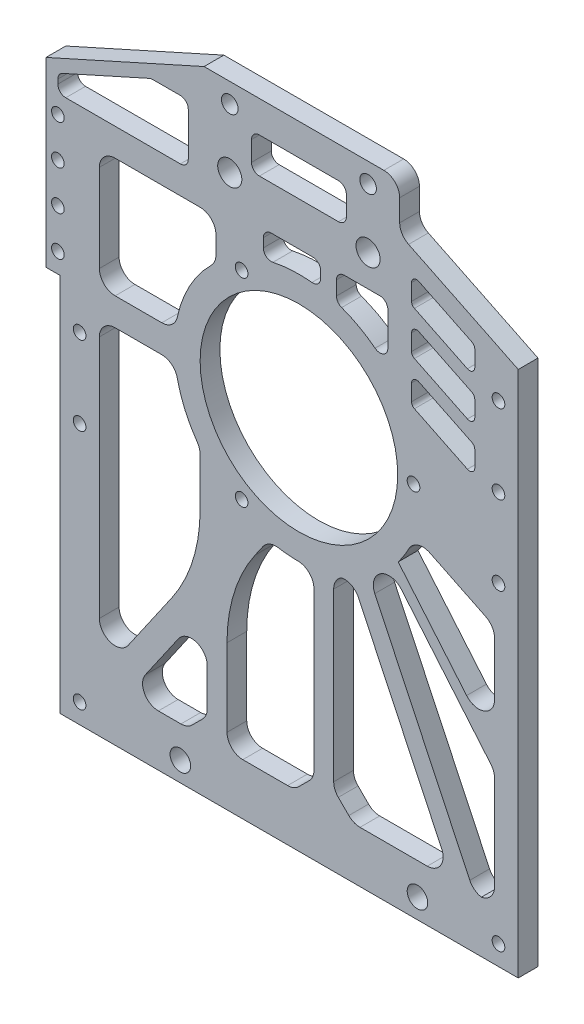
from build123d import *

# Parameters (mm, degrees)
SKETCH_1_W                     = 111
SKETCH_1_H                     = 160
EXTRUDE_1_DEPTH                = 5
SKETCH_2_R                     = 2.6
CUT_EXTRUDE_1_DEPTH            = 98.49487166
SKETCH_3_R                     = 25
CUT_EXTRUDE_2_DEPTH            = 98.49487166
SKETCH_4_R                     = 1.6
CUT_EXTRUDE_3_DEPTH            = 98.49487166
SKETCH_6_R                     = 2.1
SKETCH_6_R_2                   = 3.0525
CUT_EXTRUDE_4_DEPTH            = 98.49487166
CUT_EXTRUDE_5_DEPTH            = 98.49487166
CUT_EXTRUDE_6_DEPTH            = 98.49487166
FILLET_1_R                     = 4
SKETCH_10_W                    = 8.5
SKETCH_10_H                    = 64
EXTRUDE_3_DEPTH                = 5
SKETCH_11_R                    = 1.6
CUT_EXTRUDE_7_DEPTH            = 103.571925984
CUT_EXTRUDE_8_DEPTH            = 103.571925984
SKETCH_13_W                    = 5
SKETCH_13_H                    = 96
EXTRUDE_4_DEPTH                = 5
SKETCH_19_R                    = 1.6
CUT_EXTRUDE_13_DEPTH           = 103.571925984
CUT_EXTRUDE_9_DEPTH            = 103.571925984
FILLET_2_R                     = 1.3
PATTERN_LINEAR_1_COUNT         = 3
PATTERN_LINEAR_1_PITCH         = 11
FILLET_2_OF_PATTERN_LINEAR_1_R = 1.3
CUT_EXTRUDE_11_DEPTH           = 103.571925984
FILLET_3_R                     = 2
CUT_EXTRUDE_12_DEPTH           = 10
FILLET_5_R                     = 40
CHAMFER_1_SIZE                 = 5
FILLET_6_R                     = 4
CUT_EXTRUDE_14_DEPTH           = 103.571925984
FILLET_7_R                     = 2


with BuildPart() as part:
    # 草图1 → 凸台-拉伸1 (new body)
    with BuildSketch(Plane.XY):
        Rectangle(SKETCH_1_W, SKETCH_1_H)
    extrude(amount=EXTRUDE_1_DEPTH)

    # 草图2 → 切除-拉伸1 (cut, through all)
    with BuildSketch(Plane.XY.offset(5)):
        with Locations((-30, -75)):
            Circle(SKETCH_2_R)
        with Locations(Location((30, -75, 0), (0, 0, 180))):
            Circle(SKETCH_2_R)
    extrude(amount=-CUT_EXTRUDE_1_DEPTH, mode=Mode.SUBTRACT)

    # 草图3 → 切除-拉伸2 (cut, through all)
    with BuildSketch(Plane.XY.offset(5)):
        with Locations((0, 15)):
            Circle(SKETCH_3_R)
    extrude(amount=-CUT_EXTRUDE_2_DEPTH, mode=Mode.SUBTRACT)

    # 草图4 → 切除-拉伸3 (cut, through all)
    with BuildSketch(Plane.XY.offset(5)):
        with Locations((-14.5, 40.11473671)):
            Circle(SKETCH_4_R)
        with Locations((29, 15)):
            Circle(SKETCH_4_R)
        with Locations((-14.5, -10.11473671)):
            Circle(SKETCH_4_R)
    extrude(amount=-CUT_EXTRUDE_3_DEPTH, mode=Mode.SUBTRACT)

    # 草图6 → 切除-拉伸4 (cut, through all)
    with BuildSketch(Plane.XY.offset(5)):
        with Locations((-17.5, 75)):
            Circle(SKETCH_6_R)
        with Locations((17.5, 75)):
            Circle(SKETCH_6_R)
        with Locations((17.5, 60)):
            Circle(SKETCH_6_R_2)
        with Locations((-17.5, 60)):
            Circle(SKETCH_6_R_2)
    extrude(amount=-CUT_EXTRUDE_4_DEPTH, mode=Mode.SUBTRACT)

    # 草图7 → 切除-拉伸5 (cut, through all)
    with BuildSketch(Plane.XY.offset(5)):
        with BuildLine():
            Line((10, 63), (-10, 63))
            ThreePointArc((-10, 63), (-11.414213562, 63.585786438), (-12, 65))
            Line((-12, 65), (-12, 70))
            ThreePointArc((-12, 70), (-11.414213562, 71.414213562), (-10, 72))
            Line((-10, 72), (10, 72))
            ThreePointArc((10, 72), (11.414213562, 71.414213562), (12, 70))
            Line((12, 70), (12, 65))
            ThreePointArc((12, 65), (11.414213562, 63.585786438), (10, 63))
        make_face()
    extrude(amount=-CUT_EXTRUDE_5_DEPTH, mode=Mode.SUBTRACT)

    # 草图8 → 切除-拉伸6 (cut, through all)
    with BuildSketch(Plane.XY.offset(5)):
        Polygon((25.5, 80), (25.5, 68), (55.5, 53.368022343), (55.5, 80), align=None)
    extrude(amount=-CUT_EXTRUDE_6_DEPTH, mode=Mode.SUBTRACT)

    # 圆角1
    fillet_1_edges = [part.edges().sort_by_distance(p)[0] for p in [
        (25.5, 80, 2.5),
        (25.5, 68, 2.5),
    ]]
    fillet(fillet_1_edges, radius=FILLET_1_R)

    # 草图10 → 凸台-拉伸3 (add)
    with BuildSketch(Plane.XY):
        with Locations((-59.75, 48)):
            Rectangle(SKETCH_10_W, SKETCH_10_H)
    extrude(amount=EXTRUDE_3_DEPTH)

    # 草图11 → 切除-拉伸7 (cut, through all)
    with BuildSketch(Plane.XY.offset(5)):
        with Locations((-61, 21)):
            Circle(SKETCH_11_R)
        with Locations((-61, 41)):
            Circle(SKETCH_11_R)
        with Locations((-61, 31)):
            Circle(SKETCH_11_R)
        with Locations((-61, 51)):
            Circle(SKETCH_11_R)
    extrude(amount=-CUT_EXTRUDE_7_DEPTH, mode=Mode.SUBTRACT)

    # 草图12 → 切除-拉伸8 (cut, through all)
    with BuildSketch(Plane.XY.offset(5)):
        Polygon((-64, 80), (-64, 62), (-24, 80), align=None)
    extrude(amount=-CUT_EXTRUDE_8_DEPTH, mode=Mode.SUBTRACT)

    # 草图13 → 凸台-拉伸4 (add)
    with BuildSketch(Plane.XY):
        with Locations((-58, -32)):
            Rectangle(SKETCH_13_W, SKETCH_13_H)
    extrude(amount=EXTRUDE_4_DEPTH)

    # 草图19 → 切除-拉伸13 (cut, through all)
    with BuildSketch(Plane.XY.offset(5)):
        with Locations((-55.5, -75)):
            Circle(SKETCH_19_R)
        with Locations((50.5, -75)):
            Circle(SKETCH_19_R)
        with Locations((-55.5, 6)):
            Circle(SKETCH_19_R)
        with Locations((-55.5, -14)):
            Circle(SKETCH_19_R)
        with Locations((50.5, 44)):
            Circle(SKETCH_19_R)
        with Locations((50.5, 24)):
            Circle(SKETCH_19_R)
        with Locations((50.5, 4)):
            Circle(SKETCH_19_R)
    extrude(amount=-CUT_EXTRUDE_13_DEPTH, mode=Mode.SUBTRACT)

    # 草图14 → 切除-拉伸9 (cut, through all)
    with BuildSketch(Plane.XY.offset(5)):
        Polygon((28.5, 60.973792532), (44.5, 53.170071115), (44.5, 46.170071115), (28.5, 53.973792532), align=None)
    cut_extrude_9 = extrude(amount=-CUT_EXTRUDE_9_DEPTH, mode=Mode.SUBTRACT)

    # 圆角2
    fillet_2_edges = [part.edges().sort_by_distance(p)[0] for p in [
        (28.5, 53.973792532, 2.5),
        (28.5, 60.973792532, 2.5),
        (44.5, 53.170071115, 2.5),
        (44.5, 46.170071115, 2.5),
    ]]
    fillet(fillet_2_edges, radius=FILLET_2_R)

    # 阵列(线性)1: 切除-拉伸9 ×3
    with Locations(*[(0, -i * PATTERN_LINEAR_1_PITCH, 0) for i in range(1, PATTERN_LINEAR_1_COUNT)]):
        add(cut_extrude_9, mode=Mode.SUBTRACT)

    # 圆角2 of 阵列(线性)1
    fillet_2_of_pattern_linear_1_edges = [part.edges().sort_by_distance(p)[0] for p in [
        (28.5, 42.973792532, 2.5),
        (28.5, 49.973792532, 2.5),
        (44.5, 42.170071115, 2.5),
        (44.5, 35.170071115, 2.5),
        (28.5, 31.973792532, 2.5),
        (28.5, 38.973792532, 2.5),
        (44.5, 31.170071115, 2.5),
        (44.5, 24.170071115, 2.5),
    ]]
    fillet(fillet_2_of_pattern_linear_1_edges, radius=FILLET_2_OF_PATTERN_LINEAR_1_R)

    # 草图17 → 切除-拉伸11 (cut, through all)
    with BuildSketch(Plane.XY.offset(5)):
        Polygon((-61, 60.06024317), (-37.444444444, 70.66024317), (-28, 70.66024317), (-28, 55.66024317), (-61, 55.66024317), align=None)
    extrude(amount=-CUT_EXTRUDE_11_DEPTH, mode=Mode.SUBTRACT)

    # 圆角3
    fillet_3_edges = [part.edges().sort_by_distance(p)[0] for p in [
        (-61, 55.66024317, 2.5),
        (-61, 60.06024317, 2.5),
        (-37.444444444, 70.66024317, 2.5),
        (-28, 70.66024317, 2.5),
        (-28, 55.66024317, 2.5),
    ]]
    fillet(fillet_3_edges, radius=FILLET_3_R)

    # 草图18 → 切除-拉伸12 (cut)
    with BuildSketch(Plane.XY.offset(5)):
        with BuildLine():
            Line((-21, 48.66024317), (-50.5, 48.66024317))
            Line((-50.5, 48.66024317), (-50.5, 18.5))
            Line((-50.5, 18.5), (-31.304951685, 18.5))
            ThreePointArc((-31.304951685, 18.5), (-27.995343249, 29.439901537), (-21, 38.478713764))
            Line((-21, 38.478713764), (-21, 48.66024317))
        make_face()
        with BuildLine():
            ThreePointArc((-25, -4.163767897), (-29.221572549, 3.237785168), (-31.304951685, 11.5))
            Line((-31.304951685, 11.5), (-50.5, 11.5))
            Line((-50.5, 11.5), (-50.5, -67))
            Line((-50.5, -67), (-25, -30.163767897))
            Line((-25, -30.163767897), (-25, -4.163767897))
        make_face()
        with BuildLine():
            Line((49.5, -6), (29.436216546, 3.78576104))
            ThreePointArc((29.436216546, 3.78576104), (27.556807211, -0.260156497), (25.124689053, -4))
            Line((25.124689053, -4), (49.5, -33.049364392))
            Line((49.5, -33.049364392), (49.5, -6))
        make_face()
        with BuildLine():
            ThreePointArc((3.797377772, -16.270272177), (-1.933177665, -16.440623787), (-7.599696584, -15.569504606))
            Line((-7.599696584, -15.569504606), (-18.202622228, -30.886046958))
            Line((-18.202622228, -30.886046958), (-18.202622228, -67))
            Line((-18.202622228, -67), (3.797377772, -67))
            Line((3.797377772, -67), (3.797377772, -16.270272177))
        make_face()
        with BuildLine():
            Line((49.5, -37.716535873), (23.171082338, -6.33895366))
            ThreePointArc((23.171082338, -6.33895366), (20.626606513, -8.80741699), (17.820877625, -10.974339658))
            Line((17.820877625, -10.974339658), (44.328788713, -67))
            Line((44.328788713, -67), (49.5, -67))
            Line((49.5, -67), (49.5, -37.716535873))
        make_face()
        with BuildLine():
            ThreePointArc((13.472033527, -13.47374778), (11.169933365, -14.453057373), (8.797377772, -15.24658897))
            Line((8.797377772, -15.24658897), (8.797377772, -67))
            Line((8.797377772, -67), (38.797377772, -67))
            Line((38.797377772, -67), (13.472033527, -13.47374778))
        make_face()
        Polygon((-23.202622228, -38.108837566), (-43.202622228, -67), (-23.202622228, -67), align=None)
    extrude(amount=-CUT_EXTRUDE_12_DEPTH, mode=Mode.SUBTRACT)

    # 圆角5
    fillet_5_edges = [part.edges().sort_by_distance(p)[0] for p in [
        (-18.202622228, -30.886046958, 2.5),
        (-25, -30.163767897, 2.5),
    ]]
    fillet(fillet_5_edges, radius=FILLET_5_R)

    # 倒角1
    chamfer_1_edges = [part.edges().sort_by_distance(p)[0] for p in [
        (3.797377772, -67, 2.5),
        (8.797377772, -67, 2.5),
        (-23.202622228, -67, 2.5),
    ]]
    chamfer(chamfer_1_edges, length=CHAMFER_1_SIZE)

    # 圆角6
    # the kernel refuses this fillet: 4 mm, written as the material it adds along each edge
    with BuildSketch(Plane(origin=(-21, 38.478713764, 5), x_dir=(0, 1, 0), z_dir=(0, 0, -1))) as fillet_6_piece_1:
        with BuildLine():
            CenterArc((1.725452559, -4), FILLET_6_R, 90, 45.233004648)
            ThreePointArc((-1.114453506, -1.183098592), (-0.54959478, -0.59873845), (0, 0))
            Line((0, 0), (1.725452559, 0))
        make_face()
    extrude(amount=5)
    with BuildSketch(Plane(origin=(-31.304951685, 18.5, 5), x_dir=(0.16139728362233244, 0.9868895160246319, 0), z_dir=(0, 0, -1))) as fillet_6_piece_2:
        with BuildLine():
            CenterArc((3.399815797, -3.994846871), FILLET_6_R, 92.908638653, 77.803352485)
            Line((-0.547742267, -3.349257737), (0, 0))
            ThreePointArc((0, 0), (1.59842086, -0.04058089), (3.19684172, 0))
        make_face()
    extrude(amount=5)
    with BuildSketch(Plane(origin=(-50.5, 18.5, 5), x_dir=(1, 0, 0), z_dir=(0, 0, -1)), Plane(origin=(-50.5, 48.66024317, 5), x_dir=(0, -1, 0), z_dir=(0, 0, -1)), Plane(origin=(49.5, -67, 5), x_dir=(0, 1, 0), z_dir=(0, 0, -1)), Plane(origin=(-18.202622228, -67, 5), x_dir=(1, 0, 0), z_dir=(0, 0, -1))) as fillet_6_piece_3:
        with BuildLine():
            CenterArc((FILLET_6_R, -FILLET_6_R), FILLET_6_R, 90, 90)
            Line((0, -FILLET_6_R), (0, 0))
            Line((0, 0), (FILLET_6_R, 0))
        make_face()
    extrude(amount=5)
    with BuildSketch(Plane(origin=(-21, 48.66024317, 5), x_dir=(0, -1, 0), z_dir=(0, 0, -1)), Plane(origin=(-50.5, 11.5, 5), x_dir=(1, 0, 0), z_dir=(0, 0, -1))) as fillet_6_piece_4:
        with BuildLine():
            CenterArc((FILLET_6_R, FILLET_6_R), FILLET_6_R, 180, 90)
            Line((0, FILLET_6_R), (0, 0))
            Line((0, 0), (FILLET_6_R, 0))
        make_face()
    extrude(amount=5)
    with BuildSketch(Plane(origin=(17.820877625, -10.974339658, 5), x_dir=(0.42768360403520445, -0.9039285009553899, 0), z_dir=(0, 0, -1))) as fillet_6_piece_5:
        with BuildLine():
            CenterArc((3.239566587, -4), FILLET_6_R, 90, 75.314027374)
            ThreePointArc((-0.629752812, -2.985915493), (-0.278697124, -1.500588239), (0, 0))
            Line((0, 0), (3.239566587, 0))
        make_face()
    extrude(amount=5)
    with BuildSketch(Plane(origin=(23.171082338, -6.33895366, 5), x_dir=(-0.7228982960258316, -0.6909544511781867, 0), z_dir=(0, 0, -1))) as fillet_6_piece_6:
        with BuildLine():
            CenterArc((4.266923554, -3.991880091), FILLET_6_R, 93.651377208, 90.054332305)
            Line((0.275286823, -4.250407091), (0, 0))
            ThreePointArc((0, 0), (2.006090925, -0.06394428), (4.012181849, 0))
        make_face()
    extrude(amount=5)
    with BuildSketch(Plane(origin=(49.5, -37.716535873, 5), x_dir=(-0.6427876096865414, 0.7660444431189763, 0), z_dir=(0, 0, -1))) as fillet_6_piece_7:
        with BuildLine():
            CenterArc((FILLET_6_R * 0.363970234266, -FILLET_6_R), FILLET_6_R, 90, 40)
            Line((-FILLET_6_R * 0.27881737542, -FILLET_6_R * 0.233955556881), (0, 0))
            Line((0, 0), (FILLET_6_R * 0.363970234266, 0))
        make_face()
    extrude(amount=5)
    with BuildSketch(Plane(origin=(44.328788713, -67, 5), x_dir=(-0.42768360403520433, 0.9039285009553901, 0), z_dir=(0, 0, -1))) as fillet_6_piece_8:
        with BuildLine():
            CenterArc((FILLET_6_R * 0.633143434862, FILLET_6_R), FILLET_6_R, 205.320645409, 64.679354591)
            Line((-FILLET_6_R * 0.270785066093, FILLET_6_R * 0.572316395965), (0, 0))
            Line((0, 0), (FILLET_6_R * 0.633143434862, 0))
        make_face()
    extrude(amount=5)
    with BuildSketch(Plane(origin=(29.436216546, 3.78576104, 5), x_dir=(-0.4127265463779804, -0.9108549818247166, 0), z_dir=(0, 0, -1))) as fillet_6_piece_9:
        with BuildLine():
            CenterArc((4.114783879, -3.992449346), FILLET_6_R, 93.521018014, 88.102754335)
            Line((0.116390102, -4.105794868), (0, 0))
            ThreePointArc((0, 0), (1.93456257, -0.059461397), (3.86912514, 0))
        make_face()
    extrude(amount=5)
    with BuildSketch(Plane(origin=(49.5, -6, 5), x_dir=(-0.8987940462991693, 0.4383711467890726, 0), z_dir=(0, 0, -1))) as fillet_6_piece_10:
        with BuildLine():
            CenterArc((FILLET_6_R * 0.624869351909, -FILLET_6_R), FILLET_6_R, 90, 64)
            Line((-FILLET_6_R * 0.27392469439, -FILLET_6_R * 0.561628853211), (0, 0))
            Line((0, 0), (FILLET_6_R * 0.624869351909, 0))
        make_face()
    extrude(amount=5)
    with BuildSketch(Plane(origin=(49.5, -33.049364392, 5), x_dir=(-0.6427876096865407, 0.7660444431189769, 0), z_dir=(0, 0, -1))) as fillet_6_piece_11:
        with BuildLine():
            CenterArc((FILLET_6_R * 2.74747741945, FILLET_6_R), FILLET_6_R, 130, 140)
            Line((FILLET_6_R * 2.10468980977, FILLET_6_R * 1.76604444312), (0, 0))
            Line((0, 0), (FILLET_6_R * 2.74747741945, 0))
        make_face()
    extrude(amount=5)
    with BuildSketch(Plane(origin=(-7.599696584, -15.569504606, 5), x_dir=(0.979240345628077, -0.2027026035703641, 0), z_dir=(0, 0, -1))) as fillet_6_piece_12:
        with BuildLine():
            CenterArc((2.648970144, 3.996872449), FILLET_6_R, 202.997998756, 64.736114996)
            Line((-1.033103858, 2.434076543), (0, 0))
            ThreePointArc((0, 0), (1.245411336, 0.02462946), (2.490822672, 0))
        make_face()
    extrude(amount=5)
    with BuildSketch(Plane(origin=(3.797377772, -16.270272177, 5), x_dir=(0, -1, 0), z_dir=(0, 0, -1))) as fillet_6_piece_13:
        with BuildLine():
            CenterArc((4.229149568, 4), FILLET_6_R, 180.327027085, 89.672972915)
            ThreePointArc((0.229214723, 3.977169326), (0.177543846, 1.984957468), (0, 0))
            Line((0, 0), (4.229149568, 0))
        make_face()
    extrude(amount=5)
    with BuildSketch(Plane(origin=(8.797377772, -15.24658897, 5), x_dir=(0, -1, 0), z_dir=(0, 0, -1))) as fillet_6_piece_14:
        with BuildLine():
            CenterArc((2.866506961, -4), FILLET_6_R, 90, 68.869738164)
            ThreePointArc((-0.864546102, -2.558041941), (-0.404850945, -1.28828887), (0, 0))
            Line((0, 0), (2.866506961, 0))
        make_face()
    extrude(amount=5)
    with BuildSketch(Plane(origin=(13.472033527, -13.47374778, 5), x_dir=(0.42768360403520445, -0.90392850095539, 0), z_dir=(0, 0, -1))) as fillet_6_piece_15:
        with BuildLine():
            CenterArc((3.773928049, 4), FILLET_6_R, 186.46960161, 83.53039839)
            ThreePointArc((-0.200599055, 3.549295775), (-0.050189748, 1.777479991), (0, 0))
            Line((0, 0), (3.773928049, 0))
        make_face()
    extrude(amount=5)
    with BuildSketch(Plane(origin=(38.797377772, -67, 5), x_dir=(-1, 0, 0), z_dir=(0, 0, -1))) as fillet_6_piece_16:
        with BuildLine():
            CenterArc((FILLET_6_R * 1.57942094151, FILLET_6_R), FILLET_6_R, 154.679354591, 115.320645409)
            Line((FILLET_6_R * 0.675492440553, FILLET_6_R * 1.42768360404), (0, 0))
            Line((0, 0), (FILLET_6_R * 1.57942094151, 0))
        make_face()
    extrude(amount=5)
    with BuildSketch(Plane(origin=(-31.304951685, 11.5, 5), x_dir=(0.16139728362233252, -0.9868895160246319, 0), z_dir=(0, 0, -1))) as fillet_6_piece_17:
        with BuildLine():
            CenterArc((3.399815797, 3.994846871), FILLET_6_R, 189.288008862, 77.803352485)
            Line((-0.547742267, 3.349257737), (0, 0))
            ThreePointArc((0, 0), (1.59842086, 0.04058089), (3.19684172, 0))
        make_face()
    extrude(amount=5)
    with BuildSketch(Plane(origin=(-25, -4.163767897, 5), x_dir=(0, -1, 0), z_dir=(0, 0, -1))) as fillet_6_piece_18:
        with BuildLine():
            CenterArc((1.311827333, 4), FILLET_6_R, 234.775805019, 35.224194981)
            ThreePointArc((-0.995281989, 0.732394366), (-0.494049262, 0.371078142), (0, 0))
            Line((0, 0), (1.311827333, 0))
        make_face()
    extrude(amount=5)
    with BuildSketch(Plane(origin=(-50.5, -67, 5), x_dir=(0.5691796975413561, 0.8222131547881792, 0), z_dir=(0, 0, -1))) as fillet_6_piece_19:
        with BuildLine():
            CenterArc((FILLET_6_R * 3.20147250975, -FILLET_6_R), FILLET_6_R, 90, 145.306956642)
            Line((FILLET_6_R * 2.63229281221, -FILLET_6_R * 1.82221315479), (0, 0))
            Line((0, 0), (FILLET_6_R * 3.20147250975, 0))
        make_face()
    extrude(amount=5)
    with BuildSketch(Plane(origin=(-43.202622228, -67, 5), x_dir=(0.569179697541356, 0.8222131547881792, 0), z_dir=(0, 0, -1))) as fillet_6_piece_20:
        with BuildLine():
            CenterArc((FILLET_6_R * 1.90848284098, FILLET_6_R), FILLET_6_R, 145.306956642, 124.693043358)
            Line((FILLET_6_R * 1.08626968619, FILLET_6_R * 1.56917969754), (0, 0))
            Line((0, 0), (FILLET_6_R * 1.90848284098, 0))
        make_face()
    extrude(amount=5)
    with BuildSketch(Plane(origin=(-23.202622228, -38.108837566, 5), x_dir=(0, -1, 0), z_dir=(0, 0, -1))) as fillet_6_piece_21:
        with BuildLine():
            CenterArc((FILLET_6_R * 3.20147250975, FILLET_6_R), FILLET_6_R, 124.693043358, 145.306956642)
            Line((FILLET_6_R * 2.63229281221, FILLET_6_R * 1.82221315479), (0, 0))
            Line((0, 0), (FILLET_6_R * 3.20147250975, 0))
        make_face()
    extrude(amount=5)
    with BuildSketch(Plane(origin=(-23.202622228, -62, 5), x_dir=(0, 1, 0), z_dir=(0, 0, -1)), Plane(origin=(-28.202622228, -67, 5), x_dir=(0.7071067811865465, 0.7071067811865487, 0), z_dir=(0, 0, -1)), Plane(origin=(13.797377772, -67, 5), x_dir=(1, 0, 0), z_dir=(0, 0, -1)), Plane(origin=(8.797377772, -62, 5), x_dir=(0.707106781186547, -0.707106781186548, 0), z_dir=(0, 0, -1))) as fillet_6_piece_22:
        with BuildLine():
            CenterArc((FILLET_6_R * 0.414213562373, -FILLET_6_R), FILLET_6_R, 90, 45)
            Line((-FILLET_6_R * 0.292893218813, -FILLET_6_R * 0.292893218813), (0, 0))
            Line((0, 0), (FILLET_6_R * 0.414213562373, 0))
        make_face()
    extrude(amount=5)
    with BuildSketch(Plane(origin=(3.797377772, -62, 5), x_dir=(-0.7071067811865471, -0.7071067811865479, 0), z_dir=(0, 0, -1)), Plane(origin=(-1.202622228, -67, 5), x_dir=(-1, 0, 0), z_dir=(0, 0, -1))) as fillet_6_piece_23:
        with BuildLine():
            CenterArc((FILLET_6_R * 0.414213562373, FILLET_6_R), FILLET_6_R, 225, 45)
            Line((-FILLET_6_R * 0.292893218813, FILLET_6_R * 0.292893218813), (0, 0))
            Line((0, 0), (FILLET_6_R * 0.414213562373, 0))
        make_face()
    extrude(amount=5)

    # 草图20 → 切除-拉伸14 (cut, through all)
    with BuildSketch(Plane.XY.offset(5)):
        with BuildLine():
            Line((-9, 52), (-9, 45.186917696))
            ThreePointArc((-9, 45.186917696), (-1.798442693, 46.448618473), (5.5, 46.016124839))
            Line((5.5, 46.016124839), (5.5, 52))
            Line((5.5, 52), (-9, 52))
        make_face()
        with BuildLine():
            Line((9.5, 52), (9.5, 45.033314835))
            ThreePointArc((9.5, 45.033314835), (16.490957072, 41.838374296), (22.5, 37.045407685))
            Line((22.5, 37.045407685), (22.5, 52))
            Line((22.5, 52), (9.5, 52))
        make_face()
    extrude(amount=-CUT_EXTRUDE_14_DEPTH, mode=Mode.SUBTRACT)

    # 圆角7
    fillet_7_edges = [part.edges().sort_by_distance(p)[0] for p in [
        (5.5, 46.016124839, 2.5),
        (-9, 45.186917696, 2.5),
        (-9, 52, 2.5),
        (5.5, 52, 2.5),
        (22.5, 37.045407685, 2.5),
        (9.5, 45.033314835, 2.5),
        (9.5, 52, 2.5),
        (22.5, 52, 2.5),
    ]]
    fillet(fillet_7_edges, radius=FILLET_7_R)


solid = part.part
